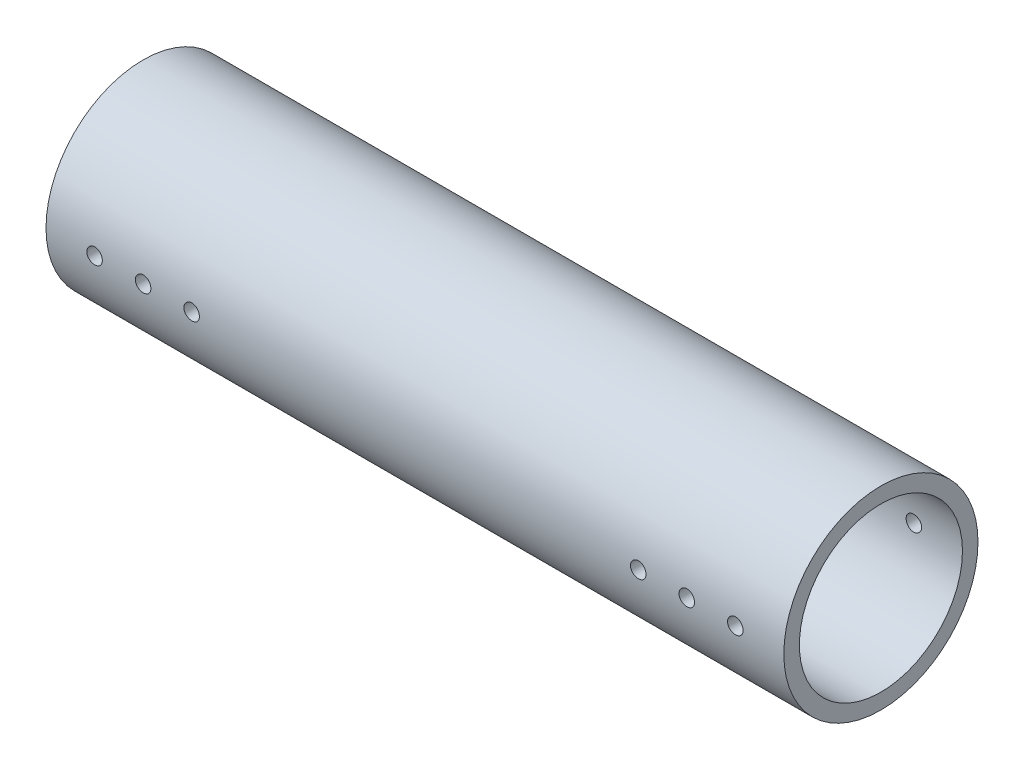
from build123d import *

# Parameters (mm, degrees)
SKETCH_2_R               = 25
SKETCH_2_R_2             = 21
EXTRUDE_2_DEPTH          = 190
CUT_EXTRUDE_2_DEPTH      = 10
CUT_EXTRUDE_2_DEPTH_BACK = 199.053023203
SKETCH_4_R               = 2


with BuildPart() as part:
    # Эскиз2 → Бобышка-Вытянуть2 (new body)
    with BuildSketch(Plane(origin=(0, 0, 0), x_dir=(0, 0, -1), z_dir=(1, 0, 0))):
        Circle(SKETCH_2_R)
        Circle(SKETCH_2_R_2, mode=Mode.SUBTRACT)
    extrude(amount=EXTRUDE_2_DEPTH)

    # Эскиз4 → Вырез-Вытянуть2 (cut, two sides: drawn at the far end of the back side and taken through both)
    with BuildSketch(Plane.XY.offset(25).offset(-CUT_EXTRUDE_2_DEPTH_BACK)):
        with Locations((12.5, 0)):
            Circle(SKETCH_4_R)
        with Locations((177.5, 0)):
            Circle(SKETCH_4_R)
        with Locations((25, 0)):
            Circle(SKETCH_4_R)
        with Locations((37.5, 0)):
            Circle(SKETCH_4_R)
        with Locations((165, 0)):
            Circle(SKETCH_4_R)
        with Locations((152.5, 0)):
            Circle(SKETCH_4_R)
    extrude(amount=CUT_EXTRUDE_2_DEPTH + CUT_EXTRUDE_2_DEPTH_BACK, mode=Mode.SUBTRACT)


solid = part.part
